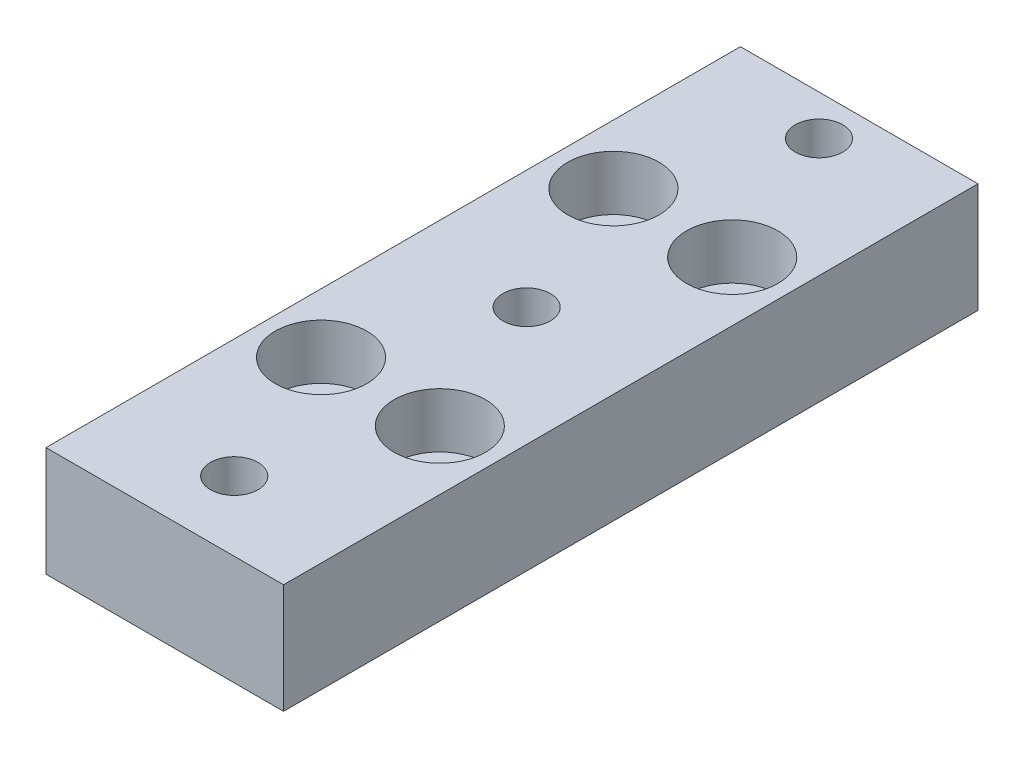
from build123d import *

# Parameters (mm, degrees)
SKETCH1_W                    = 6.5
SKETCH1_H                    = 19
BOSS_BODY_DEPTH              = 3
SKETCH2_R                    = 0.65
CUT_SCREW_HOLES_DEPTH        = 11.479145958
SKETCH4_R                    = 1.25
CUT_SCREW_HEAD_POCKETS_DEPTH = 1.5


with BuildPart() as part:
    # Sketch1 → Boss-Body (new body)
    with BuildSketch(Plane(origin=(0, 0, 0), x_dir=(1, 0, 0), z_dir=(0, 1, 0))):
        Rectangle(SKETCH1_W, SKETCH1_H)
    extrude(amount=-BOSS_BODY_DEPTH)

    # Sketch2 → Cut-Screw Holes (cut, through all)
    with BuildSketch(Plane(origin=(0, 0, 0), x_dir=(1, 0, 0), z_dir=(0, 1, 0))):
        with Locations((0, -7.6)):
            Circle(SKETCH2_R)
        with Locations((0, 0.4)):
            Circle(SKETCH2_R)
        with Locations((0, 8.4)):
            Circle(SKETCH2_R)
        with Locations((1.625, 4.4)):
            Circle(SKETCH2_R)
        with Locations((-1.625, -3.6)):
            Circle(SKETCH2_R)
        with Locations((-1.625, 4.4)):
            Circle(SKETCH2_R)
        with Locations((1.625, -3.6)):
            Circle(SKETCH2_R)
    extrude(amount=-CUT_SCREW_HOLES_DEPTH, mode=Mode.SUBTRACT)

    # Sketch4 → Cut-Screw Head Pockets (cut)
    with BuildSketch(Plane(origin=(0, 0, 0), x_dir=(1, 0, 0), z_dir=(0, 1, 0))):
        with Locations((1.625, 4.4)):
            Circle(SKETCH4_R)
        with Locations((-1.625, -3.6)):
            Circle(SKETCH4_R)
        with Locations((-1.625, 4.4)):
            Circle(SKETCH4_R)
        with Locations((1.625, -3.6)):
            Circle(SKETCH4_R)
    extrude(amount=-CUT_SCREW_HEAD_POCKETS_DEPTH, mode=Mode.SUBTRACT)


solid = part.part
